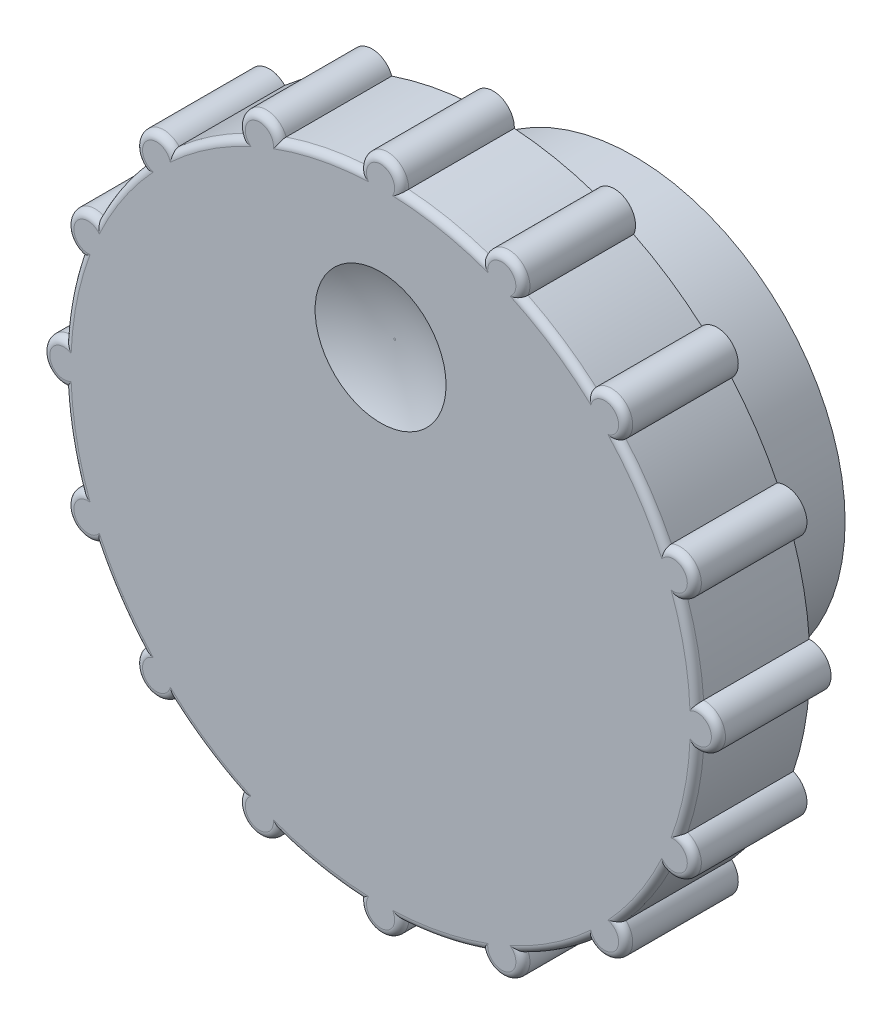
from build123d import *

# Parameters (mm, degrees)
SKETCH_1_R          = 15
EXTRUDE_1_DEPTH     = 10
EXTRUDE_2_DEPTH     = 8
FILLET_2_R          = 0.5
SKETCH_3_R          = 4.651802014
CUT_EXTRUDE_2_DEPTH = 1
FILLET_3_R          = 11


with BuildPart() as part:
    # Эскиз1 → Бобышка-Вытянуть1 (new body)
    with BuildSketch(Plane.XY):
        Circle(SKETCH_1_R)
        with BuildLine():
            Line((2.884874347, 1.496662955), (-2.884874347, 1.496662955))
            ThreePointArc((-2.884874347, 1.496662955), (0, -3.25), (2.884874347, 1.496662955))
        make_face(mode=Mode.SUBTRACT)
    extrude(amount=EXTRUDE_1_DEPTH)

    # Эскиз2 → Бобышка-Вытянуть2 (add)
    with BuildSketch(Plane.XY.offset(10)):
        with BuildLine():
            ThreePointArc((-1.499166435, 22.45), (-4.389532245, 22.067668809), (-7.206193871, 21.314801662))
            ThreePointArc((-7.206193871, 21.314801662), (-9.184402377, 22.17310878), (-9.976292242, 20.167389348))
            ThreePointArc((-9.976292242, 20.167389348), (-12.500330243, 18.708066277), (-14.814476485, 16.93461799))
            ThreePointArc((-14.814476485, 16.93461799), (-16.970562748, 16.970562748), (-16.93461799, 14.814476485))
            ThreePointArc((-16.93461799, 14.814476485), (-18.708066277, 12.500330243), (-20.167389348, 9.976292242))
            ThreePointArc((-20.167389348, 9.976292242), (-22.17310878, 9.184402377), (-21.314801662, 7.206193871))
            ThreePointArc((-21.314801662, 7.206193871), (-22.067668809, 4.389532245), (-22.45, 1.499166435))
            ThreePointArc((-22.45, 1.499166435), (-24, 0), (-22.45, -1.499166435))
            ThreePointArc((-22.45, -1.499166435), (-22.067668809, -4.389532245), (-21.314801662, -7.206193871))
            ThreePointArc((-21.314801662, -7.206193871), (-22.17310878, -9.184402377), (-20.167389348, -9.976292242))
            ThreePointArc((-20.167389348, -9.976292242), (-18.708066277, -12.500330243), (-16.93461799, -14.814476485))
            ThreePointArc((-16.93461799, -14.814476485), (-16.970562748, -16.970562748), (-14.814476485, -16.93461799))
            ThreePointArc((-14.814476485, -16.93461799), (-12.500330243, -18.708066277), (-9.976292242, -20.167389348))
            ThreePointArc((-9.976292242, -20.167389348), (-9.184402377, -22.17310878), (-7.206193871, -21.314801662))
            ThreePointArc((-7.206193871, -21.314801662), (-4.389532245, -22.067668809), (-1.499166435, -22.45))
            ThreePointArc((-1.499166435, -22.45), (0, -24), (1.499166435, -22.45))
            ThreePointArc((1.499166435, -22.45), (4.389532245, -22.067668809), (7.206193871, -21.314801662))
            ThreePointArc((7.206193871, -21.314801662), (9.184402377, -22.17310878), (9.976292242, -20.167389348))
            ThreePointArc((9.976292242, -20.167389348), (12.500330243, -18.708066277), (14.814476485, -16.93461799))
            ThreePointArc((14.814476485, -16.93461799), (16.970562748, -16.970562748), (16.93461799, -14.814476485))
            ThreePointArc((16.93461799, -14.814476485), (18.708066277, -12.500330243), (20.167389348, -9.976292242))
            ThreePointArc((20.167389348, -9.976292242), (22.17310878, -9.184402377), (21.314801662, -7.206193871))
            ThreePointArc((21.314801662, -7.206193871), (22.067668809, -4.389532245), (22.45, -1.499166435))
            ThreePointArc((22.45, -1.499166435), (24, 0), (22.45, 1.499166435))
            ThreePointArc((22.45, 1.499166435), (22.067668809, 4.389532245), (21.314801662, 7.206193871))
            ThreePointArc((21.314801662, 7.206193871), (22.17310878, 9.184402377), (20.167389348, 9.976292242))
            ThreePointArc((20.167389348, 9.976292242), (18.708066277, 12.500330243), (16.93461799, 14.814476485))
            ThreePointArc((16.93461799, 14.814476485), (16.970562748, 16.970562748), (14.814476485, 16.93461799))
            ThreePointArc((14.814476485, 16.93461799), (12.500330243, 18.708066277), (9.976292242, 20.167389348))
            ThreePointArc((9.976292242, 20.167389348), (9.184402377, 22.17310878), (7.206193871, 21.314801662))
            ThreePointArc((7.206193871, 21.314801662), (4.389532245, 22.067668809), (1.499166435, 22.45))
            ThreePointArc((1.499166435, 22.45), (0, 24), (-1.499166435, 22.45))
        make_face()
    extrude(amount=EXTRUDE_2_DEPTH)

    # Скругление2
    fillet_2_edges = [part.edges().sort_by_distance(p)[0] for p in [
        (-9.184402377, 22.17310878, 18),
        (-12.500330243, 18.708066277, 18),
        (-16.970562748, 16.970562748, 18),
        (-18.708066277, 12.500330243, 18),
        (-22.17310878, 9.184402377, 18),
        (-22.067668809, 4.389532245, 18),
        (-24, 0, 18),
        (-22.067668809, -4.389532245, 18),
        (-22.17310878, -9.184402377, 18),
        (-18.708066277, -12.500330243, 18),
        (-16.970562748, -16.970562748, 18),
        (-12.500330243, -18.708066277, 18),
        (-9.184402377, -22.17310878, 18),
        (-4.389532245, -22.067668809, 18),
        (0, -24, 18),
        (4.389532245, -22.067668809, 18),
        (9.184402377, -22.17310878, 18),
        (12.500330243, -18.708066277, 18),
        (16.970562748, -16.970562748, 18),
        (18.708066277, -12.500330243, 18),
        (22.17310878, -9.184402377, 18),
        (22.067668809, -4.389532245, 18),
        (24, 0, 18),
        (22.067668809, 4.389532245, 18),
        (22.17310878, 9.184402377, 18),
        (18.708066277, 12.500330243, 18),
        (16.970562748, 16.970562748, 18),
        (12.500330243, 18.708066277, 18),
        (9.184402377, 22.17310878, 18),
        (4.389532245, 22.067668809, 18),
        (0, 24, 18),
        (-4.389532245, 22.067668809, 18),
    ]]
    fillet(fillet_2_edges, radius=FILLET_2_R)

    # Эскиз3 → Вырез-Вытянуть2 (cut)
    with BuildSketch(Plane.XY.offset(18)):
        with Locations((0, 12.22345337)):
            Circle(SKETCH_3_R)
    extrude(amount=-CUT_EXTRUDE_2_DEPTH, mode=Mode.SUBTRACT)

    # Скругление3
    # the kernel refuses this fillet: 11 mm, written as the material it adds along each edge
    with BuildSketch(Plane(origin=(0, 12.22345337, 17), x_dir=(1, 0, 0), z_dir=(0, -1, 0))) as fillet_3_piece_1:
        with BuildLine():
            CenterArc((0.069226319, 11), FILLET_3_R, 270, 24.619977329)
            Line((0.069226319, 0), (0.069226319, -0.22))
            Line((0.069226319, -0.22), (4.651802014, -0.22))
            Line((4.651802014, -0.22), (4.871802014, 0))
            ThreePointArc((4.871802014, 0), (4.871802014, 0.5), (4.743453528, 0.8))
            Line((4.743453528, 0.8), (4.651802014, 1))
        make_face()
    revolve(axis=Axis((0, 12.22345337, 17), (0, 0, 1)))


solid = part.part
